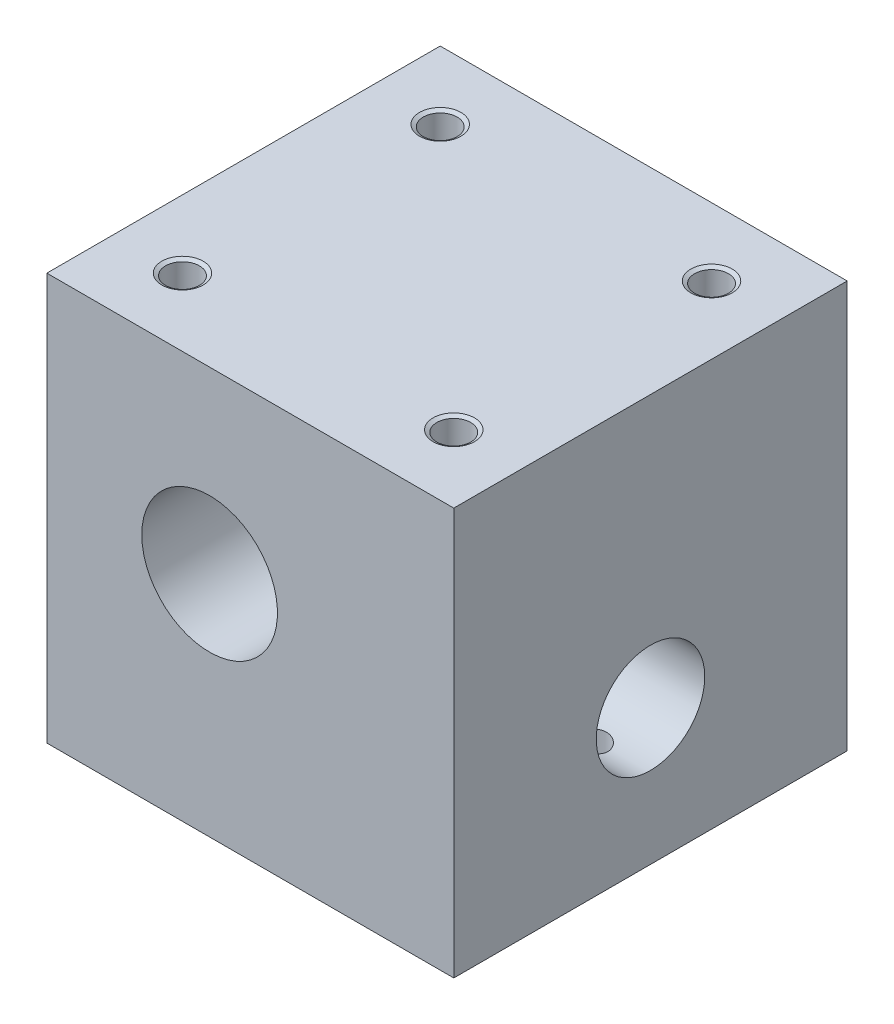
from build123d import *

# Parameters (mm, degrees)
SCHIZZO1_W                      = 30
SCHIZZO1_H                      = 30
SCHIZZO1_R                      = 5
ESTRUSIONE_ESTRUSIONE1_DEPTH    = 29
FORO_8_0_8_1_D                  = 8
FORO_8_0_8_1_DEPTH              = 12
FORO_8_0_8_1_TIP                = 2.403442476
FORO_FILETTATO_M3_1_AT_2_COUNT  = 2
FORO_FILETTATO_M3_1_AT_2_PITCH  = 20
FORO_FILETTATO_M3_2_D           = 2.5
FORO_FILETTATO_M3_2_DEPTH       = 8.5
FORO_FILETTATO_M3_2_CSINK_D     = 3.05
FORO_FILETTATO_M3_2_CSINK_ANGLE = 120
FORO_FILETTATO_M3_2_TIP         = 0.751075774


with BuildPart() as part:
    # Schizzo1 → Estrusione-Estrusione1 (new body)
    with BuildSketch(Plane.XY):
        with Locations((15, 15)):
            Rectangle(SCHIZZO1_W, SCHIZZO1_H)
        with Locations((12, 16.8)):
            Circle(SCHIZZO1_R, mode=Mode.SUBTRACT)
    extrude(amount=ESTRUSIONE_ESTRUSIONE1_DEPTH)

    # Foro Ø8.0 (8)-1
    with Locations(Plane(origin=(30, 0, 0), x_dir=(0, 0, -1), z_dir=(1, 0, 0))):
        with Locations((-14.5, 10)):
            Hole(FORO_8_0_8_1_D / 2, depth=FORO_8_0_8_1_DEPTH)
            with Locations((0, 0, -(FORO_8_0_8_1_DEPTH + FORO_8_0_8_1_TIP / 2))):  # 118° drill point
                Cone(0, FORO_8_0_8_1_D / 2, FORO_8_0_8_1_TIP, mode=Mode.SUBTRACT)

    # Schizzo7 → Foro filettato M3-1 (revolve, cut)
    with BuildSketch(Plane(origin=(5, 30, 24), x_dir=(0, 0, 1), z_dir=(1, 0, 0))):
        Polygon((0, 0), (0, 9.251075774), (1.25, 8.5), (1.25, 0.158771324), (1.525, 0), align=None)
    foro_filettato_m3_1 = revolve(axis=Axis((5, 36.35, 24), (0, -1, 0)), mode=Mode.SUBTRACT)

    # Foro filettato M3-1 at 2: Foro filettato M3-1 ×2
    with Locations(*[(i * FORO_FILETTATO_M3_1_AT_2_PITCH, 0, 0) for i in range(1, FORO_FILETTATO_M3_1_AT_2_COUNT)]):
        add(foro_filettato_m3_1, mode=Mode.SUBTRACT)

    # Specchia1: Foro filettato M3-1 across plane
    add(foro_filettato_m3_1.mirror(Plane.XY.offset(14.5)), mode=Mode.SUBTRACT)

    # Specchia1 copy 1 sketch → Specchia1 copy 1 (revolve, cut)
    with BuildSketch(Plane(origin=(25, 30, 5), x_dir=(0, 0, -1), z_dir=(1, 0, 0))):
        Polygon((0, 0), (0, -9.251075774), (1.25, -8.5), (1.25, -0.158771324), (1.525, 0), align=None)
    revolve(axis=Axis((25, 36.35, 5), (0, 1, 0)), mode=Mode.SUBTRACT)

    # Foro filettato M3-2
    with Locations(Plane(origin=(0, 0, 0), x_dir=(-1, 0, 0), z_dir=(0, -1, 0))):
        with Locations((-26, -15)):
            CounterSinkHole(FORO_FILETTATO_M3_2_D / 2, FORO_FILETTATO_M3_2_CSINK_D / 2, depth=FORO_FILETTATO_M3_2_DEPTH, counter_sink_angle=FORO_FILETTATO_M3_2_CSINK_ANGLE)
            with Locations((0, 0, -(FORO_FILETTATO_M3_2_DEPTH + FORO_FILETTATO_M3_2_TIP / 2))):  # 118° drill point
                Cone(0, FORO_FILETTATO_M3_2_D / 2, FORO_FILETTATO_M3_2_TIP, mode=Mode.SUBTRACT)


solid = part.part
